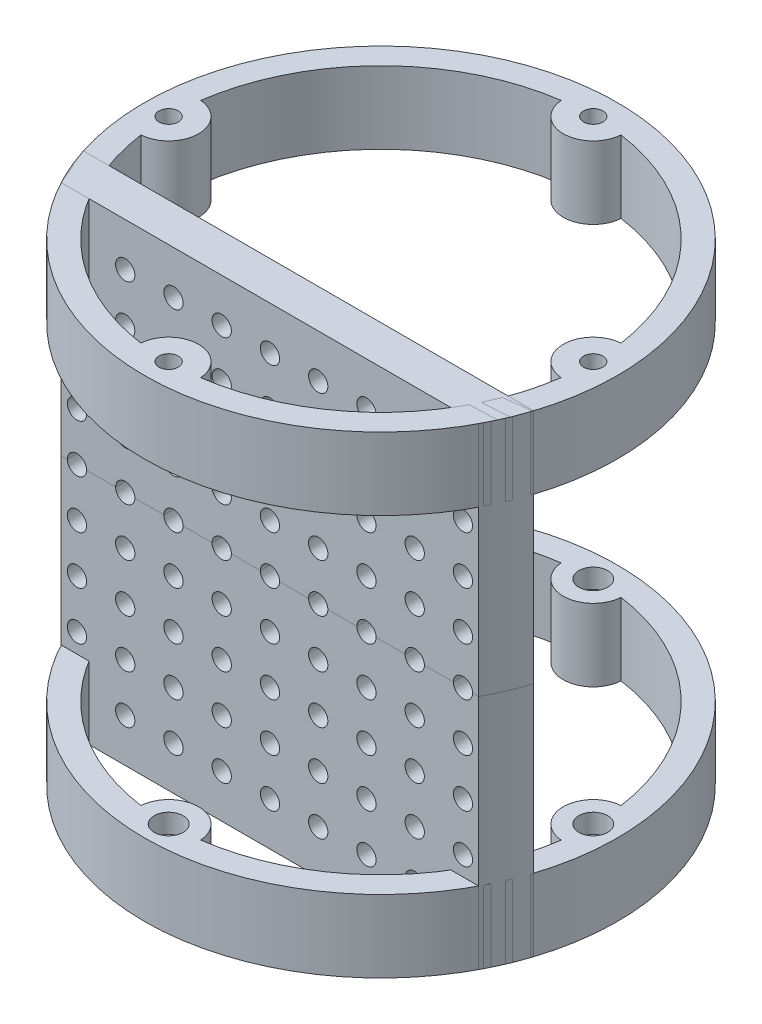
from build123d import *

# Parameters (mm, degrees)
SKETCH1_R                = 49
SKETCH1_R_2              = 1.55
BOSS_EXTRUDE1_DEPTH      = 15
BOSS_EXTRUDE2_DEPTH      = 34
BOSS_EXTRUDE2_DEPTH_BACK = 15
SKETCH3_R                = 3
CUT_EXTRUDE1_DEPTH       = 4
CIRPATTERN1_COUNT        = 4
SKETCH4_R                = 2
CUT_EXTRUDE2_DEPTH       = 15
CIRPATTERN2_COUNT        = 4
SKETCH6_R                = 2
CUT_EXTRUDE3_DEPTH       = 8
FILL_START               = 15
FILL_PATTERN1_OUTLINE_R  = 2
FILL_PATTERN1_DEPTH      = 8


# Read off the part's stored shape, not the designer's step: Fill Pattern1
with BuildPart() as part:
    # Sketch1 → Boss-Extrude1 (new body)
    with BuildSketch(Plane(origin=(0, 0, 0), x_dir=(1, 0, 0), z_dir=(0, 1, 0))):
        with Locations(Location((0, 0, 0), (0, 0, 270))):
            Circle(SKETCH1_R)
        with BuildLine():
            ThreePointArc((43.561522491, 6.196269703), (37.788235294, 0), (43.561522491, -6.196269703))
            ThreePointArc((43.561522491, -6.196269703), (31.112698372, -31.112698372), (6.196269703, -43.561522491))
            ThreePointArc((6.196269703, -43.561522491), (0, -37.788235294), (-6.196269703, -43.561522491))
            ThreePointArc((-6.196269703, -43.561522491), (-31.112698372, -31.112698372), (-43.561522491, -6.196269703))
            ThreePointArc((-43.561522491, -6.196269703), (-37.788235294, 0), (-43.561522491, 6.196269703))
            ThreePointArc((-43.561522491, 6.196269703), (-31.112698372, 31.112698372), (-6.196269703, 43.561522491))
            ThreePointArc((-6.196269703, 43.561522491), (0, 37.788235294), (6.196269703, 43.561522491))
            ThreePointArc((6.196269703, 43.561522491), (31.112698372, 31.112698372), (43.561522491, 6.196269703))
        make_face(mode=Mode.SUBTRACT)
        with Locations(Location((-44, 0, 0), (0, 0, 270))):
            Circle(SKETCH1_R_2, mode=Mode.SUBTRACT)
        with Locations(Location((0, -44, 0), (0, 0, 270))):
            Circle(SKETCH1_R_2, mode=Mode.SUBTRACT)
        with Locations(Location((0, 44, 0), (0, 0, 270))):
            Circle(SKETCH1_R_2, mode=Mode.SUBTRACT)
        with Locations(Location((44, 0, 0), (0, 0, 270))):
            Circle(SKETCH1_R_2, mode=Mode.SUBTRACT)
    extrude(amount=BOSS_EXTRUDE1_DEPTH)


with BuildPart() as body_2:
    # Sketch2 → Boss-Extrude2 (new, two sides: drawn at the far end of the back side and taken through both)
    with BuildSketch(Plane(origin=(0, 15, 0), x_dir=(1, 0, 0), z_dir=(0, 1, 0)).offset(-BOSS_EXTRUDE2_DEPTH_BACK)):
        with BuildLine():
            Line((-41.36423576, -15), (-46.647615159, -15))
            ThreePointArc((-46.647615159, -15), (-45.134711808, -19.07505675), (-43.266615306, -23))
            Line((-43.266615306, -23), (-37.509998667, -23))
            ThreePointArc((-37.509998667, -23), (-39.639452747, -19.09748114), (-41.36423576, -15))
        make_face()
        with BuildLine():
            Line((41.36423576, -15), (-41.36423576, -15))
            ThreePointArc((-41.36423576, -15), (-39.639452747, -19.09748114), (-37.509998667, -23))
            Line((-37.509998667, -23), (37.509998667, -23))
            ThreePointArc((37.509998667, -23), (39.639452747, -19.09748114), (41.36423576, -15))
        make_face()
        with BuildLine():
            Line((46.647615159, -15), (41.36423576, -15))
            ThreePointArc((41.36423576, -15), (39.639452747, -19.09748114), (37.509998667, -23))
            Line((37.509998667, -23), (43.266615306, -23))
            ThreePointArc((43.266615306, -23), (45.134711808, -19.07505675), (46.647615159, -15))
        make_face()
    extrude(amount=BOSS_EXTRUDE2_DEPTH + BOSS_EXTRUDE2_DEPTH_BACK)


with BuildPart() as body_3:
    # Mirror7: mirrored copy
    add(part.part.mirror(Plane(origin=(0, 49, 18.950111488), x_dir=(0, 0, 1), z_dir=(0, 1, 0))))

    # Sketch4 → Cut-Extrude2 (cut)
    with BuildSketch(Plane(origin=(0, 98, 0), x_dir=(1, 0, 0), z_dir=(0, 1, 0))):
        with Locations(Location((0, 44, 0), (0, 0, 270))):
            Circle(SKETCH4_R)
    cut_extrude2 = extrude(amount=-CUT_EXTRUDE2_DEPTH, mode=Mode.SUBTRACT)

    # CirPattern2: Cut-Extrude2 ×4 about axis
    cirpattern2_axis = Axis((0, 0, 0), (0, 1, 0))
    for i in range(1, CIRPATTERN2_COUNT):
        add(cut_extrude2.rotate(cirpattern2_axis, i * 360 / CIRPATTERN2_COUNT), mode=Mode.SUBTRACT)


with BuildPart() as body_4:
    # Mirror7 2: mirrored copy
    add(body_2.part.mirror(Plane(origin=(0, 49, 18.950111488), x_dir=(0, 0, 1), z_dir=(0, 1, 0))))


with BuildPart() as part_1:
    add(part.part)

    # Sketch3 → Cut-Extrude1 (cut)
    with BuildSketch(Plane(origin=(0, 15, 0), x_dir=(1, 0, 0), z_dir=(0, 1, 0))):
        with Locations(Location((0, 44, 0), (0, 0, 270))):
            Circle(SKETCH3_R)
    cut_extrude1 = extrude(amount=-CUT_EXTRUDE1_DEPTH, mode=Mode.SUBTRACT)

    # CirPattern1: Cut-Extrude1 ×4 about axis
    cirpattern1_axis = Axis((0, 0, 0), (0, 1, 0))
    for i in range(1, CIRPATTERN1_COUNT):
        add(cut_extrude1.rotate(cirpattern1_axis, i * 360 / CIRPATTERN1_COUNT), mode=Mode.SUBTRACT)


with BuildPart() as cut_extrude3_tool:
    # Sketch6 → Cut-Extrude3 (new body)
    with BuildSketch(Plane(origin=(0, 0, 15), x_dir=(-1, 0, 0), z_dir=(0, 0, -1))):
        with Locations((0, 49)):
            Circle(SKETCH6_R)
    extrude(amount=-CUT_EXTRUDE3_DEPTH)


with BuildPart() as body_2_1:
    add(body_2.part)

    # Cut-Extrude3: cut by cut_extrude3_tool
    add(cut_extrude3_tool.part, mode=Mode.SUBTRACT)


with BuildPart() as body_4_1:
    add(body_4.part)

    # Cut-Extrude3: cut by cut_extrude3_tool
    add(cut_extrude3_tool.part, mode=Mode.SUBTRACT)


with BuildPart() as fill_pattern1_tool:
    # Fill Pattern1 outline → Fill Pattern1 (new body)
    with BuildSketch(Plane.XY.offset(FILL_START)):
        with Locations((40, 49)):
            Circle(FILL_PATTERN1_OUTLINE_R)
        with Locations((30, 49)):
            Circle(FILL_PATTERN1_OUTLINE_R)
        with Locations((20, 49)):
            Circle(FILL_PATTERN1_OUTLINE_R)
        with Locations((10, 49)):
            Circle(FILL_PATTERN1_OUTLINE_R)
        with Locations((10, 59)):
            Circle(FILL_PATTERN1_OUTLINE_R)
        with Locations((0, 59)):
            Circle(FILL_PATTERN1_OUTLINE_R)
        with Locations((-10, 59)):
            Circle(FILL_PATTERN1_OUTLINE_R)
        with Locations((-10, 49)):
            Circle(FILL_PATTERN1_OUTLINE_R)
        with Locations((-40, 49)):
            Circle(FILL_PATTERN1_OUTLINE_R)
        with Locations((-30, 49)):
            Circle(FILL_PATTERN1_OUTLINE_R)
        with Locations((-20, 49)):
            Circle(FILL_PATTERN1_OUTLINE_R)
        with Locations((20, 59)):
            Circle(FILL_PATTERN1_OUTLINE_R)
        with Locations((20, 69)):
            Circle(FILL_PATTERN1_OUTLINE_R)
        with Locations((10, 69)):
            Circle(FILL_PATTERN1_OUTLINE_R)
        with Locations((0, 69)):
            Circle(FILL_PATTERN1_OUTLINE_R)
        with Locations((-10, 69)):
            Circle(FILL_PATTERN1_OUTLINE_R)
        with Locations((-20, 69)):
            Circle(FILL_PATTERN1_OUTLINE_R)
        with Locations((-20, 59)):
            Circle(FILL_PATTERN1_OUTLINE_R)
        with Locations((30, 59)):
            Circle(FILL_PATTERN1_OUTLINE_R)
        with Locations((30, 69)):
            Circle(FILL_PATTERN1_OUTLINE_R)
        with Locations((30, 79)):
            Circle(FILL_PATTERN1_OUTLINE_R)
        with Locations((20, 79)):
            Circle(FILL_PATTERN1_OUTLINE_R)
        with Locations((10, 79)):
            Circle(FILL_PATTERN1_OUTLINE_R)
        with Locations((0, 79)):
            Circle(FILL_PATTERN1_OUTLINE_R)
        with Locations((-10, 79)):
            Circle(FILL_PATTERN1_OUTLINE_R)
        with Locations((-20, 79)):
            Circle(FILL_PATTERN1_OUTLINE_R)
        with Locations((-30, 79)):
            Circle(FILL_PATTERN1_OUTLINE_R)
        with Locations((-30, 69)):
            Circle(FILL_PATTERN1_OUTLINE_R)
        with Locations((-30, 59)):
            Circle(FILL_PATTERN1_OUTLINE_R)
        with Locations((40, 59)):
            Circle(FILL_PATTERN1_OUTLINE_R)
        with Locations((40, 69)):
            Circle(FILL_PATTERN1_OUTLINE_R)
        with Locations((40, 79)):
            Circle(FILL_PATTERN1_OUTLINE_R)
        with Locations((30, 89)):
            Circle(FILL_PATTERN1_OUTLINE_R)
        with Locations((20, 89)):
            Circle(FILL_PATTERN1_OUTLINE_R)
        with Locations((10, 89)):
            Circle(FILL_PATTERN1_OUTLINE_R)
        with Locations((0, 89)):
            Circle(FILL_PATTERN1_OUTLINE_R)
        with Locations((-10, 89)):
            Circle(FILL_PATTERN1_OUTLINE_R)
        with Locations((-20, 89)):
            Circle(FILL_PATTERN1_OUTLINE_R)
        with Locations((-30, 89)):
            Circle(FILL_PATTERN1_OUTLINE_R)
        with Locations((-40, 79)):
            Circle(FILL_PATTERN1_OUTLINE_R)
        with Locations((-40, 69)):
            Circle(FILL_PATTERN1_OUTLINE_R)
        with Locations((-40, 59)):
            Circle(FILL_PATTERN1_OUTLINE_R)
        with Locations((-10, 39)):
            Circle(FILL_PATTERN1_OUTLINE_R)
        with Locations((0, 39)):
            Circle(FILL_PATTERN1_OUTLINE_R)
        with Locations((10, 39)):
            Circle(FILL_PATTERN1_OUTLINE_R)
        with Locations((-20, 29)):
            Circle(FILL_PATTERN1_OUTLINE_R)
        with Locations((-10, 29)):
            Circle(FILL_PATTERN1_OUTLINE_R)
        with Locations((0, 29)):
            Circle(FILL_PATTERN1_OUTLINE_R)
        with Locations((10, 29)):
            Circle(FILL_PATTERN1_OUTLINE_R)
        with Locations((20, 29)):
            Circle(FILL_PATTERN1_OUTLINE_R)
        with Locations((20, 39)):
            Circle(FILL_PATTERN1_OUTLINE_R)
        with Locations((-20, 39)):
            Circle(FILL_PATTERN1_OUTLINE_R)
        with Locations((-30, 19)):
            Circle(FILL_PATTERN1_OUTLINE_R)
        with Locations((-20, 19)):
            Circle(FILL_PATTERN1_OUTLINE_R)
        with Locations((-10, 19)):
            Circle(FILL_PATTERN1_OUTLINE_R)
        with Locations((0, 19)):
            Circle(FILL_PATTERN1_OUTLINE_R)
        with Locations((10, 19)):
            Circle(FILL_PATTERN1_OUTLINE_R)
        with Locations((20, 19)):
            Circle(FILL_PATTERN1_OUTLINE_R)
        with Locations((30, 19)):
            Circle(FILL_PATTERN1_OUTLINE_R)
        with Locations((30, 29)):
            Circle(FILL_PATTERN1_OUTLINE_R)
        with Locations((30, 39)):
            Circle(FILL_PATTERN1_OUTLINE_R)
        with Locations((-30, 39)):
            Circle(FILL_PATTERN1_OUTLINE_R)
        with Locations((-30, 29)):
            Circle(FILL_PATTERN1_OUTLINE_R)
        with Locations((-30, 9)):
            Circle(FILL_PATTERN1_OUTLINE_R)
        with Locations((-20, 9)):
            Circle(FILL_PATTERN1_OUTLINE_R)
        with Locations((-10, 9)):
            Circle(FILL_PATTERN1_OUTLINE_R)
        with Locations((0, 9)):
            Circle(FILL_PATTERN1_OUTLINE_R)
        with Locations((10, 9)):
            Circle(FILL_PATTERN1_OUTLINE_R)
        with Locations((20, 9)):
            Circle(FILL_PATTERN1_OUTLINE_R)
        with Locations((30, 9)):
            Circle(FILL_PATTERN1_OUTLINE_R)
        with Locations((40, 19)):
            Circle(FILL_PATTERN1_OUTLINE_R)
        with Locations((40, 29)):
            Circle(FILL_PATTERN1_OUTLINE_R)
        with Locations((40, 39)):
            Circle(FILL_PATTERN1_OUTLINE_R)
        with Locations((-40, 39)):
            Circle(FILL_PATTERN1_OUTLINE_R)
        with Locations((-40, 29)):
            Circle(FILL_PATTERN1_OUTLINE_R)
        with Locations((-40, 19)):
            Circle(FILL_PATTERN1_OUTLINE_R)
    extrude(amount=FILL_PATTERN1_DEPTH)


with BuildPart() as body_2_2:
    add(body_2_1.part)

    # Fill Pattern1: cut by fill_pattern1_tool
    add(fill_pattern1_tool.part, mode=Mode.SUBTRACT)


with BuildPart() as body_4_2:
    add(body_4_1.part)

    # Fill Pattern1: cut by fill_pattern1_tool
    add(fill_pattern1_tool.part, mode=Mode.SUBTRACT)


solid = Compound([body_3.part, part_1.part, body_2_2.part, body_4_2.part])
